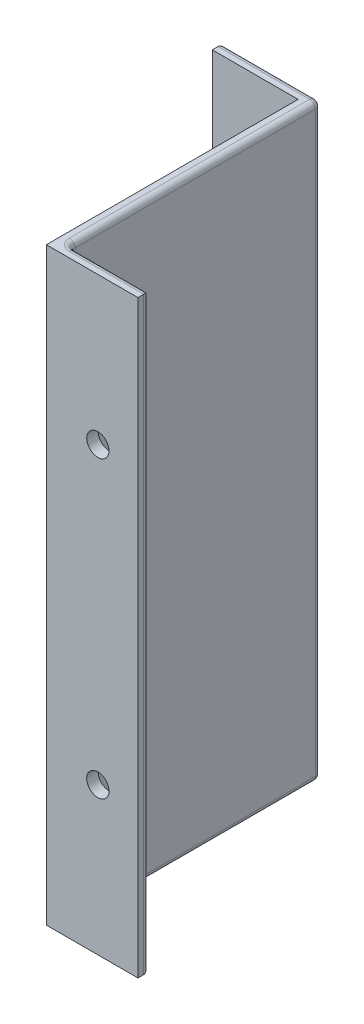
from build123d import *

# Parameters (mm, degrees)
RESSALTO_EXTRUS_O1_DEPTH = 103
ESBO_O2_R                = 1.95
CORTE_EXTRUS_O1_DEPTH    = 2
CORTE_EXTRUS_O2_DEPTH    = 0.5
FILETE1_R                = 1


with BuildPart() as part:
    # Esboço1 → Ressalto-extrusão1 (new body)
    with BuildSketch(Plane(origin=(0, 0, 0), x_dir=(1, 0, 0), z_dir=(0, 1, 0))):
        Polygon((0, 0), (16, 0), (16, 2), (2, 2), (2, 46), (-15, 46), (-15, 44), (0, 44), align=None)
    extrude(amount=RESSALTO_EXTRUS_O1_DEPTH)

    # Esboço2 → Corte-extrusão1 (cut)
    with BuildSketch(Plane(origin=(0, 0, -2), x_dir=(-1, 0, 0), z_dir=(0, 0, -1))):
        with Locations((-9, 77.25)):
            Circle(ESBO_O2_R)
        with Locations((-9, 25.75)):
            Circle(ESBO_O2_R)
    extrude(amount=-CORTE_EXTRUS_O1_DEPTH, mode=Mode.SUBTRACT)

    # Esboço3 → Corte-extrusão2 (cut)
    # profile 1 of 8: a face of its own
    with BuildSketch(Plane(origin=(0, 0, -2), x_dir=(-1, 0, 0), z_dir=(0, 0, -1))):
        Polygon((-12.5, 60.721153846), (-12.5, 61.057692308), (-9.743890224, 62.223657853), (-12.5, 63.390324519), (-12.5, 63.727564103), (-9, 62.246794872), (-9, 62.201923077), align=None)
    # profile 2 of 8: a face of its own
    with BuildSketch(Plane(origin=(0, 0, -2), x_dir=(-1, 0, 0), z_dir=(0, 0, -1))):
        with BuildLine():
            Line((-11.423076923, 58.432692308), (-11.423076923, 58.118589744))
            add(Edge.make_bspline(
                [(-11.423076923, 58.118589744), (-11.464747811, 58.120636897), (-11.546588325, 58.124657451), (-11.665912232, 58.14348574), (-11.779967031, 58.170426617), (-11.887836945, 58.208518071), (-11.990475752, 58.255824349), (-12.087475767, 58.312554376), (-12.178466956, 58.379748227), (-12.262605799, 58.455954961), (-12.33979337, 58.5387236), (-12.406448613, 58.628029539), (-12.462766284, 58.721874567), (-12.509847526, 58.819973966), (-12.545187372, 58.923434529), (-12.571409012, 59.031317387), (-12.587185357, 59.144096523), (-12.588881143, 59.220936545), (-12.58974359, 59.260016026)],
                knots=[0, 0, 0, 0, 1.10065271, 2.161652631, 3.183658789, 4.190468796, 5.17591951, 6.163126047, 7.15150782, 8.156236427, 9.156009102, 10.134482811, 11.092018607, 12.041330605, 13.001268258, 13.972401359, 14.968799086, 16, 16, 16, 16], degree=3))
            add(Edge.make_bspline(
                [(-12.58974359, 59.260016026), (-12.588852424, 59.298396801), (-12.587101316, 59.373813652), (-12.571837144, 59.483837459), (-12.54844616, 59.588826559), (-12.513784407, 59.687591109), (-12.47029149, 59.781144713), (-12.416202348, 59.868329021), (-12.354076299, 59.951252241), (-12.280795578, 60.025844646), (-12.202604863, 60.094366768), (-12.119097837, 60.153428695), (-12.032749001, 60.204293291), (-11.942883845, 60.245924374), (-11.849209723, 60.277482586), (-11.752624723, 60.300864197), (-11.652014188, 60.314230389), (-11.583905673, 60.316270491), (-11.549278846, 60.317307692)],
                knots=[0, 0, 0, 0, 1.111674182, 2.184400057, 3.212814286, 4.223731311, 5.211378316, 6.196328225, 7.191884489, 8.207283132, 9.220262353, 10.201199469, 11.166417575, 12.120932471, 13.06540007, 14.026332106, 14.996573967, 16, 16, 16, 16], degree=3))
            add(Edge.make_bspline(
                [(-11.549278846, 60.317307692), (-11.500530165, 60.315615866), (-11.403888274, 60.312261902), (-11.261885815, 60.283526473), (-11.12424519, 60.238760085), (-11.013479624, 60.184415929), (-10.924023761, 60.130564808), (-10.8505287, 60.081718469), (-10.771712368, 60.024110035), (-10.686615211, 59.95820849), (-10.596722591, 59.882657453), (-10.499528359, 59.800472163), (-10.398131849, 59.707985246), (-10.328796454, 59.643361966), (-10.29286859, 59.609875801)],
                knots=[0, 0, 0, 0, 1.184287764, 2.347792955, 3.508658517, 4.695561027, 5.337795753, 6.047029248, 6.840419152, 7.71111932, 8.663527678, 9.695323177, 10.80577421, 12, 12, 12, 12], degree=3))
            Line((-10.29286859, 59.609875801), (-9.358974359, 58.734174679))
            Line((-9.358974359, 58.734174679), (-9.358974359, 60.362179487))
            Line((-9.358974359, 60.362179487), (-9, 60.362179487))
            Line((-9, 60.362179487), (-9, 57.983974359))
            Line((-9, 57.983974359), (-10.448517628, 59.341346154))
            add(Edge.make_bspline(
                [(-10.448517628, 59.341346154), (-10.483015935, 59.374394041), (-10.549280121, 59.437872268), (-10.646023081, 59.527654845), (-10.735772622, 59.608293833), (-10.818359171, 59.680311226), (-10.894990738, 59.742144731), (-10.963185442, 59.797016963), (-11.025939892, 59.840982554), (-11.098680506, 59.88869795), (-11.187492823, 59.934911931), (-11.296026513, 59.974624287), (-11.407753765, 59.998839136), (-11.483255802, 60.001743971), (-11.521233974, 60.003205128)],
                knots=[0, 0, 0, 0, 1.329631726, 2.553950428, 3.673215718, 4.687767853, 5.603093632, 6.413772471, 7.123043292, 7.734684054, 8.834405432, 9.900288307, 10.943827018, 12, 12, 12, 12], degree=3))
            add(Edge.make_bspline(
                [(-11.521233974, 60.003205128), (-11.545115373, 60.002569386), (-11.592181023, 60.00131646), (-11.661186782, 59.990258762), (-11.727751596, 59.973548256), (-11.792080215, 59.949602998), (-11.853525867, 59.917996258), (-11.912163347, 59.879522878), (-11.968852313, 59.835132815), (-12.022005611, 59.783781546), (-12.070686816, 59.727370026), (-12.113810902, 59.667775776), (-12.149850012, 59.604725672), (-12.179393509, 59.53848555), (-12.202568891, 59.46924008), (-12.21862747, 59.396855335), (-12.228709954, 59.321531319), (-12.230074126, 59.270097823), (-12.230769231, 59.243890224)],
                knots=[0, 0, 0, 0, 0.991446411, 1.95395049, 2.89581595, 3.838931463, 4.798493298, 5.75982156, 6.748411868, 7.785213223, 8.824556874, 9.840280684, 10.836137867, 11.835679398, 12.848801643, 13.863922112, 14.911575587, 16, 16, 16, 16], degree=3))
            add(Edge.make_bspline(
                [(-12.230769231, 59.243890224), (-12.230082413, 59.216512522), (-12.228733615, 59.162747234), (-12.218517149, 59.083975444), (-12.203028983, 59.008311704), (-12.178430394, 58.936884984), (-12.149365939, 58.868148585), (-12.11244268, 58.803569919), (-12.069537034, 58.742076784), (-12.019786187, 58.684680621), (-11.963887514, 58.632259658), (-11.902283318, 58.585553337), (-11.835417099, 58.545012256), (-11.76356329, 58.509591138), (-11.686006495, 58.480838784), (-11.603039645, 58.458864688), (-11.515018024, 58.441478106), (-11.454232973, 58.435669548), (-11.423076923, 58.432692308)],
                knots=[0, 0, 0, 0, 1.030878251, 2.024474673, 2.987898669, 3.934362936, 4.864849709, 5.795128259, 6.730474222, 7.685293701, 8.650606017, 9.611896181, 10.591709709, 11.591680886, 12.625074257, 13.701333388, 14.821793024, 16, 16, 16, 16], degree=3))
        make_face()
    # profile 3 of 8: a face of its own
    with BuildSketch(Plane(origin=(0, 0, -2), x_dir=(-1, 0, 0), z_dir=(0, 0, -1))):
        Polygon((-12.5, 56.035556891), (-12.5, 56.682692308), (-9, 56.682692308), (-9, 56.368589744), (-12.141025641, 56.368589744), (-12.141025641, 55.830128205), align=None)
    # profile 4 of 8: a face of its own
    with BuildSketch(Plane(origin=(0, 0, -2), x_dir=(-1, 0, 0), z_dir=(0, 0, -1))):
        Polygon((-12.5, 51.657051282), (-12.5, 53.631410256), (-12.141025641, 53.631410256), (-12.141025641, 51.971153846), (-11.064102564, 51.971153846), (-11.064102564, 53.631410256), (-10.705128205, 53.631410256), (-10.705128205, 51.971153846), (-9.358974359, 51.971153846), (-9.358974359, 53.631410256), (-9, 53.631410256), (-9, 51.657051282), align=None)
    # profile 5 of 8: a face of its own
    with BuildSketch(Plane(origin=(0, 0, -2), x_dir=(-1, 0, 0), z_dir=(0, 0, -1))):
        Polygon((-12.141025641, 49.189102564), (-12.5, 49.189102564), (-12.5, 51.028846154), (-12.141025641, 51.028846154), (-12.141025641, 50.266025641), (-9, 50.266025641), (-9, 49.951923077), (-12.141025641, 49.951923077), align=None)
    # profile 6 of 8: a face of its own
    with BuildSketch(Plane(origin=(0, 0, -2), x_dir=(-1, 0, 0), z_dir=(0, 0, -1))):
        Polygon((-9, 46.003205128), (-12.5, 46.003205128), (-12.5, 46.069110577), (-9.745292468, 48.381410256), (-12.5, 48.381410256), (-12.5, 48.695512821), (-9, 48.695512821), (-9, 48.623998397), (-11.748397436, 46.317307692), (-9, 46.317307692), align=None)
    # profile 7 of 8: a face of its own
    with BuildSketch(Plane(origin=(0, 0, -2), x_dir=(-1, 0, 0), z_dir=(0, 0, -1))):
        with BuildLine():
            add(Edge.make_bspline(
                [(-12.58974359, 43.423076923), (-12.588129744, 43.487892095), (-12.584960018, 43.61519444), (-12.559895231, 43.802115963), (-12.518641215, 43.981101701), (-12.460381735, 44.152254553), (-12.384855641, 44.314923583), (-12.293113066, 44.469568209), (-12.184596472, 44.615724978), (-12.060899323, 44.752387834), (-11.925430757, 44.877056019), (-11.780409088, 44.986452998), (-11.62765762, 45.078739675), (-11.467168388, 45.154286371), (-11.299316087, 45.213595534), (-11.123159994, 45.2545117), (-10.939853875, 45.280650636), (-10.814826932, 45.283706305), (-10.751402244, 45.28525641)],
                knots=[0, 0, 0, 0, 1.065064174, 2.09187391, 3.093564831, 4.079973196, 5.057907931, 6.036227367, 7.030399151, 8.044883615, 9.061699972, 10.052012555, 11.025713132, 11.989727027, 12.962874294, 13.945865945, 14.957962116, 16, 16, 16, 16], degree=3))
            add(Edge.make_bspline(
                [(-10.751402244, 45.28525641), (-10.688445124, 45.283705784), (-10.564349346, 45.280649319), (-10.382201223, 45.254490491), (-10.207127705, 45.213412964), (-10.039519009, 45.155020699), (-9.879355736, 45.079416032), (-9.726488631, 44.986993495), (-9.581079609, 44.877804139), (-9.444677774, 44.753665359), (-9.319901677, 44.617938723), (-9.2098443, 44.473474414), (-9.11751745, 44.320727019), (-9.041127343, 44.161279455), (-8.983054174, 43.993879686), (-8.94077499, 43.819745885), (-8.914895539, 43.637929312), (-8.911819755, 43.514074262), (-8.91025641, 43.451121795)],
                knots=[0, 0, 0, 0, 1.043748596, 2.057349401, 3.045489418, 4.02252776, 4.995289225, 5.97782527, 6.980224157, 8.006516136, 9.032559198, 10.034193337, 11.013412982, 11.987833483, 12.961212594, 13.946489799, 14.956251404, 16, 16, 16, 16], degree=3))
            add(Edge.make_bspline(
                [(-8.91025641, 43.451121795), (-8.911805797, 43.387697476), (-8.914860051, 43.26267126), (-8.941041456, 43.079134225), (-8.98198276, 42.902856481), (-9.040492196, 42.73434213), (-9.116109427, 42.5734972), (-9.208313806, 42.420007117), (-9.317720947, 42.27448797), (-9.441887521, 42.138146223), (-9.577059073, 42.013397025), (-9.721893329, 41.90463765), (-9.873548785, 41.812412536), (-10.032446309, 41.737049204), (-10.197817752, 41.677384744), (-10.370766229, 41.636679926), (-10.550305735, 41.610343974), (-10.672548634, 41.607309128), (-10.734575321, 41.605769231)],
                knots=[0, 0, 0, 0, 1.053102029, 2.075944431, 3.073151272, 4.055350789, 5.033113405, 6.020478099, 7.024410459, 8.052272461, 9.079885166, 10.07527673, 11.055994387, 12.023226415, 12.992069828, 13.970394897, 14.97016774, 16, 16, 16, 16], degree=3))
            add(Edge.make_bspline(
                [(-10.734575321, 41.605769231), (-10.77620799, 41.606303866), (-10.858948113, 41.607366393), (-10.981814713, 41.620158085), (-11.102705371, 41.638719786), (-11.221276319, 41.665321699), (-11.337237304, 41.700113366), (-11.451388067, 41.741165393), (-11.56257179, 41.791305239), (-11.671315182, 41.847985887), (-11.775923088, 41.911247695), (-11.874802671, 41.981123444), (-11.968783668, 42.055158813), (-12.055430672, 42.136322206), (-12.137264328, 42.221938651), (-12.213027045, 42.31339703), (-12.283401996, 42.410139274), (-12.346822337, 42.512581654), (-12.404181472, 42.618199929), (-12.453403323, 42.727076706), (-12.495649384, 42.837733278), (-12.529890209, 42.950687926), (-12.556922245, 43.065640698), (-12.575329599, 43.182842482), (-12.588153917, 43.302199909), (-12.589211419, 43.382611228), (-12.58974359, 43.423076923)],
                knots=[0, 0, 0, 0, 1.037015668, 2.060948919, 3.074880161, 4.083647147, 5.086022904, 6.090072063, 7.104153813, 8.122640571, 9.144368836, 10.147691507, 11.138137339, 12.123020368, 13.103399296, 14.087645067, 15.080126199, 16.082011238, 17.087798457, 18.072939717, 19.057185487, 20.037253025, 21.01195951, 21.997135196, 22.992090687, 24, 24, 24, 24], degree=3))
        make_face()
        with BuildLine():
            add(Edge.make_bspline(
                [(-12.230769231, 43.438501603), (-12.230365753, 43.405286544), (-12.229562654, 43.339173966), (-12.21892606, 43.24089571), (-12.203874783, 43.14388013), (-12.182015052, 43.048314965), (-12.153740439, 42.953999796), (-12.119639024, 42.860892752), (-12.078422353, 42.769313065), (-12.032069199, 42.679375145), (-11.979419431, 42.593156263), (-11.92351052, 42.510448779), (-11.862265147, 42.433403984), (-11.797007836, 42.3609635), (-11.727172255, 42.293307478), (-11.653217023, 42.23046576), (-11.574822262, 42.17248988), (-11.492310601, 42.120077551), (-11.40614272, 42.07343467), (-11.317965778, 42.031673343), (-11.226743513, 41.997054796), (-11.133045178, 41.969631749), (-11.037283681, 41.946355866), (-10.93893728, 41.93175551), (-10.838345009, 41.921014112), (-10.770362768, 41.920255499), (-10.735977564, 41.919871795)],
                knots=[0, 0, 0, 0, 1.008406545, 2.007172654, 2.999155034, 3.989332444, 4.982025741, 5.988181096, 6.998684226, 8.030553839, 9.059268815, 10.065399129, 11.060956322, 12.046057109, 13.024974577, 14.012068307, 14.991706172, 15.984221787, 16.978487447, 17.966117052, 18.945677757, 19.938371053, 20.93015022, 21.936155317, 22.956113857, 24, 24, 24, 24], degree=3))
            add(Edge.make_bspline(
                [(-10.735977564, 41.919871795), (-10.685416493, 41.921149574), (-10.585947224, 41.92366336), (-10.440162679, 41.945579314), (-10.299921154, 41.979605997), (-10.166058545, 42.02893826), (-10.037977921, 42.091871297), (-9.916177726, 42.168636824), (-9.80069389, 42.259937855), (-9.692386073, 42.363586807), (-9.593568594, 42.476924205), (-9.50670751, 42.59721416), (-9.433602799, 42.723504981), (-9.372488904, 42.855068762), (-9.326448237, 42.993028771), (-9.293621264, 43.136500462), (-9.272345169, 43.285487005), (-9.270278754, 43.3870127), (-9.269230769, 43.438501603)],
                knots=[0, 0, 0, 0, 1.032022337, 2.030307203, 3.003823408, 3.974715386, 4.937372378, 5.913284036, 6.909147208, 7.938749767, 8.970518239, 9.975863271, 10.963918693, 11.946286286, 12.933361397, 13.927862637, 14.949112547, 16, 16, 16, 16], degree=3))
            add(Edge.make_bspline(
                [(-9.269230769, 43.438501603), (-9.26970589, 43.47311124), (-9.270648197, 43.541752547), (-9.280152496, 43.643846073), (-9.295363267, 43.744109775), (-9.317371822, 43.8423584), (-9.344552167, 43.938720673), (-9.378266584, 44.032905837), (-9.418682089, 44.124882609), (-9.463723833, 44.215103258), (-9.514890039, 44.301547657), (-9.570045247, 44.383753456), (-9.630209968, 44.460665514), (-9.694590845, 44.53307201), (-9.764211752, 44.600253878), (-9.837717532, 44.662916673), (-9.916278677, 44.719890134), (-9.99845239, 44.772124784), (-10.083992054, 44.819336779), (-10.172411414, 44.859890148), (-10.263236245, 44.894523564), (-10.356533279, 44.922442021), (-10.452092652, 44.944330197), (-10.550051131, 44.95940938), (-10.650210365, 44.969958018), (-10.717954236, 44.970753068), (-10.752103365, 44.971153846)],
                knots=[0, 0, 0, 0, 1.047334373, 2.07717862, 3.100662057, 4.115010574, 5.122652213, 6.129548646, 7.140165612, 8.16200981, 9.179904151, 10.178566626, 11.156366481, 12.133321541, 13.108841334, 14.082538371, 15.054589433, 16.043660176, 17.028268541, 18.009491307, 18.985652105, 19.968123554, 20.954864208, 21.950389976, 22.966808393, 24, 24, 24, 24], degree=3))
            add(Edge.make_bspline(
                [(-10.752103365, 44.971153846), (-10.78601887, 44.970752733), (-10.85329652, 44.969957052), (-10.952757338, 44.959414577), (-11.05001055, 44.944313687), (-11.144674352, 44.922550978), (-11.236772879, 44.894500826), (-11.326219621, 44.859913492), (-11.413347837, 44.819128206), (-11.497942055, 44.772319928), (-11.579117087, 44.719704305), (-11.65671841, 44.662209319), (-11.729295218, 44.598846743), (-11.798614701, 44.531410349), (-11.863290324, 44.458278819), (-11.923072192, 44.379439389), (-11.980653876, 44.29685506), (-12.031614304, 44.208658248), (-12.0789118, 44.11796248), (-12.119263823, 44.024812838), (-12.153920496, 43.930539635), (-12.182099457, 43.834765951), (-12.20379105, 43.737537055), (-12.218939529, 43.63890949), (-12.229559, 43.539227521), (-12.23036454, 43.472183455), (-12.230769231, 43.438501603)],
                knots=[0, 0, 0, 0, 1.029877221, 2.042951179, 3.035109885, 4.018542222, 4.991021277, 5.957494829, 6.929429462, 7.911425532, 8.892163142, 9.866273635, 10.842761649, 11.81676864, 12.802607151, 13.805177466, 14.821356543, 15.858816981, 16.897175917, 17.927346774, 18.940346092, 19.946830556, 20.957962087, 21.964146003, 22.97721996, 24, 24, 24, 24], degree=3))
        make_face(mode=Mode.SUBTRACT)
    # profile 8 of 8: a face of its own
    with BuildSketch(Plane(origin=(0, 0, -2), x_dir=(-1, 0, 0), z_dir=(0, 0, -1))):
        Polygon((-12.5, 39.451923077), (-12.5, 41.157051282), (-12.141025641, 41.157051282), (-12.141025641, 39.766025641), (-11.064102564, 39.766025641), (-11.064102564, 41.157051282), (-10.705128205, 41.157051282), (-10.705128205, 39.766025641), (-9, 39.766025641), (-9, 39.451923077), align=None)
    extrude(amount=-CORTE_EXTRUS_O2_DEPTH, mode=Mode.SUBTRACT)

    # Filete1
    filete1_edges = [part.edges().sort_by_distance(p)[0] for p in [
        (9, 103, -2),
        (9, 0, -2),
        (2, 51.5, -2),
        (2, 103, -24),
        (2, 0, -24),
        (-6.5, 103, -46),
        (-15, 51.5, -46),
        (-6.5, 0, -46),
        (16, 51.5, -2),
        (2, 51.5, -46),
    ]]
    fillet(filete1_edges, radius=FILETE1_R)


solid = part.part
